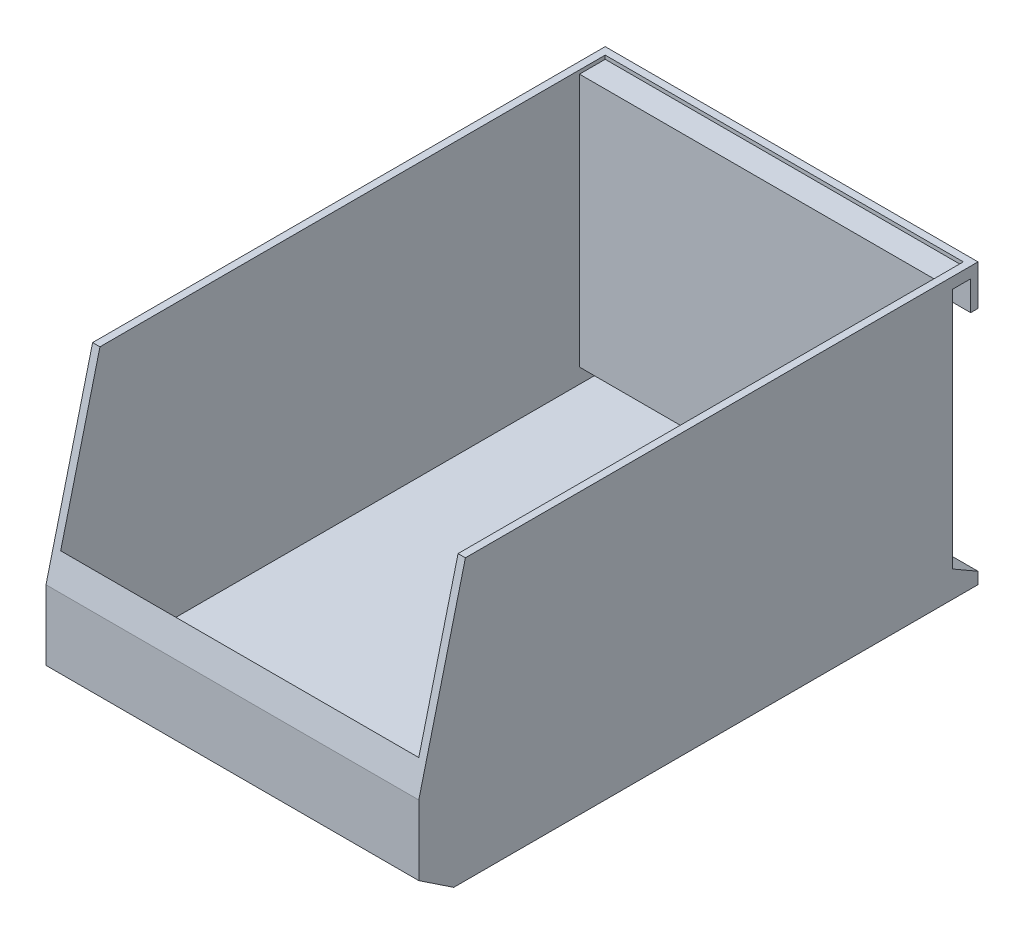
from build123d import *

# Parameters (mm, degrees)
SKETCH1_W           = 101.6
SKETCH1_H           = 152.4
BOSS_EXTRUDE1_DEPTH = 76.2
CUT_EXTRUDE1_DEPTH  = 149.106178129
CUT_EXTRUDE2_DEPTH  = 149.106178129
SHELL1_T            = -2


with BuildPart() as part:
    # Sketch1 → Boss-Extrude1 (new body)
    with BuildSketch(Plane(origin=(0, 0, 0), x_dir=(1, 0, 0), z_dir=(0, 1, 0))):
        Rectangle(SKETCH1_W, SKETCH1_H)
    extrude(amount=BOSS_EXTRUDE1_DEPTH)

    # Sketch2 → Cut-Extrude1 (cut, through all)
    with BuildSketch(Plane(origin=(50.8, 0, 0), x_dir=(0, 0, -1), z_dir=(1, 0, 0))):
        Polygon((-63.5, 76.2), (-76.2, 25.4), (-76.2, 76.2), align=None)
        Polygon((-76.2, 6.35), (-76.2, 0), (-66.675, 0), align=None)
    extrude(amount=-CUT_EXTRUDE1_DEPTH, mode=Mode.SUBTRACT)

    # Sketch3 → Cut-Extrude2 (cut, through all)
    with BuildSketch(Plane(origin=(50.8, 0, 0), x_dir=(0, 0, -1), z_dir=(1, 0, 0))):
        Polygon((69.2, 7.216451884), (69.2, 65.2), (69.2, 73.2), (74.2, 73.2), (74.2, 65.2), (76.2, 65.2), (76.2, 3.175), align=None)
    extrude(amount=-CUT_EXTRUDE2_DEPTH, mode=Mode.SUBTRACT)

    # Shell1
    shell1_openings = [part.faces().sort_by_distance(p)[0] for p in [
        (0, 76.2, -6.35),
        (0, 50.8, 69.85),
    ]]
    offset(amount=SHELL1_T, openings=shell1_openings, kind=Kind.INTERSECTION)


solid = part.part
